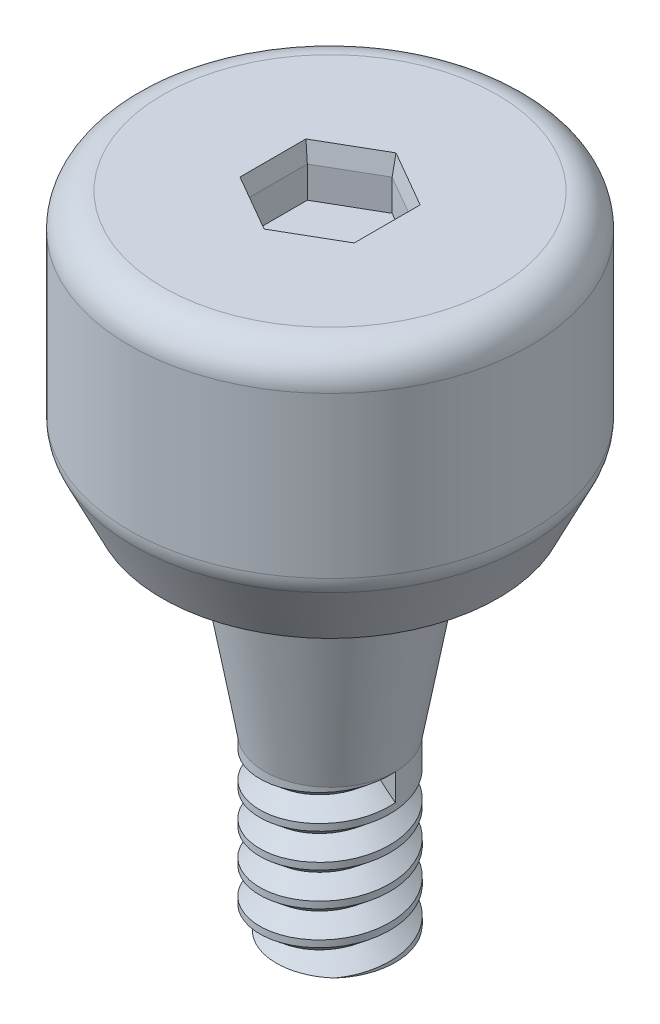
from build123d import *
from build123d.topology import SkipClean

# Parameters (mm, degrees)
ESQUISSE4_W                           = 3.292935648
ESQUISSE4_H                           = 1.153716838
ENL_V_MAT_EXTRU_2_DEPTH               = 1.5
CHANFREIN2_SIZE                       = 0.1
CHANFREIN2_SIZE2                      = 0.567128182
CONG_2_R                              = 1
ENL_VEMENT_DE_MATI_RE_BALAYAGE1_PITCH = 1


with BuildPart() as part:
    # Esquisse1 → Révolution1 (revolve)
    with BuildSketch(Plane.XY, mode=Mode.PRIVATE) as r_volution1_sk:
        with BuildLine():
            Line((-3, 0), (-1.942038116, -6))
            Line((-1.942038116, -6), (-1.942038116, -11))
            Line((-1.942038116, -11), (0, -11))
            Line((0, -11), (0, 0))
            Line((0, 0), (0, 2))
            Line((0, 2), (0, 8))
            Line((0, 8), (-5.968857154, 8))
            Line((-5.968857154, 8), (-5.968857154, 2.229461123))
            ThreePointArc((-5.968857154, 2.229461123), (-5.943526946, 2.005812298), (-5.86881956, 1.793493615))
            Line((-5.86881956, 1.793493615), (-5, 0))
            Line((-5, 0), (-3, 0))
        make_face()
    revolve(r_volution1_sk.sketch.rotate(Axis((0, -11, 0), (0, 1, 0)), 270), axis=Axis((0, -11, 0), (0, 1, 0)))

    # Esquisse4 → Enlèvement de matière-Révolution1 (revolve, cut)
    with BuildSketch(Plane.XY, mode=Mode.PRIVATE) as enl_vement_de_mati_re_r_volution1_sk:
        with Locations((1.646467824, -11.493285508)):
            Rectangle(ESQUISSE4_W, ESQUISSE4_H)
    revolve(enl_vement_de_mati_re_r_volution1_sk.sketch.rotate(Axis((0, -10.860421417, 0), (0, -1, 0)), 270), axis=Axis((0, -10.860421417, 0), (0, -1, 0)), mode=Mode.SUBTRACT)

    # Esquisse6 → Enlèv. mat.-Extru.2 (cut)
    with BuildSketch(Plane(origin=(0, 8, 0), x_dir=(1, 0, 0), z_dir=(0, 1, 0))):
        Polygon((0, 1.847520861), (-1.6, 0.923760431), (-1.6, -0.923760431), (0, -1.847520861), (1.6, -0.923760431), (1.6, 0.923760431), align=None)
    extrude(amount=-ENL_V_MAT_EXTRU_2_DEPTH, mode=Mode.SUBTRACT)

    # Chanfrein2
    chanfrein2_edges = [part.edges().sort_by_distance(p)[0] for p in [
        (0.8, 8, -1.385640646),
        (-0.8, 8, -1.385640646),
        (-1.6, 8, 0),
        (-0.8, 8, 1.385640646),
        (0.8, 8, 1.385640646),
        (1.6, 8, 0),
    ]]
    chanfrein2_side = [part.faces().sort_by_distance(p)[0] for p in [
        (0, 8, 5.800032379),
    ]]
    chamfer(chanfrein2_edges, length=CHANFREIN2_SIZE, length2=CHANFREIN2_SIZE2, reference=chanfrein2_side[0])

    # Congé2
    cong_2_edges = [part.edges().sort_by_distance(p)[0] for p in [
        (0, 8, 5.968857154),
    ]]
    fillet(cong_2_edges, radius=CONG_2_R)

    # Enlèvement de matière-Balayage1: the profile of Esquisse3 profile screwed along a right-hand helix of 5 turns, 8 arcs to a turn; built about Z, then put on its axis
    with SkipClean():  # the faces are left unmerged after this step: merging them gives an invalid solid
        enl_vement_de_mati_re_balayage1_z = Axis((0, 0, 0), (0, 0, 1))
        enl_vement_de_mati_re_balayage1_corners = [(1.942338116, 0, -0.000244898), (1.942338116, 0, 0.800244898), (1.452038116, 0, 0.4)]
        with BuildLine(mode=Mode.PRIVATE) as enl_vement_de_mati_re_balayage1_profile:
            Line(enl_vement_de_mati_re_balayage1_corners[0], enl_vement_de_mati_re_balayage1_corners[1])
            Line(enl_vement_de_mati_re_balayage1_corners[1], enl_vement_de_mati_re_balayage1_corners[2])
            Line(enl_vement_de_mati_re_balayage1_corners[2], enl_vement_de_mati_re_balayage1_corners[0])
        enl_vement_de_mati_re_balayage1_cap = Face(enl_vement_de_mati_re_balayage1_profile.wire())
        enl_vement_de_mati_re_balayage1_turn_angles = [0, 22.5, 45, 67.5, 90, 112.5, 135, 157.5, 180, 202.5, 225, 247.5, 270, 292.5, 315, 337.5, 360]
        enl_vement_de_mati_re_balayage1_turn_weights = [1, 0.9238795325112867, 1, 0.9238795325112867, 1, 0.9238795325112867, 1, 0.9238795325112867, 1, 0.9238795325112867, 1, 0.9238795325112867, 1, 0.9238795325112867, 1, 0.9238795325112867, 1]
        enl_vement_de_mati_re_balayage1_turn_rails = [Edge.make_bspline([Vector(p[0], p[1], 0).rotate(enl_vement_de_mati_re_balayage1_z, enl_vement_de_mati_re_balayage1_turn_angles[k]) / enl_vement_de_mati_re_balayage1_turn_weights[k] + Vector(0, 0, p[2] + ENL_VEMENT_DE_MATI_RE_BALAYAGE1_PITCH * enl_vement_de_mati_re_balayage1_turn_angles[k] / 360) for k in range(17)], [0, 0, 0, 1, 1, 2, 2, 3, 3, 4, 4, 5, 5, 6, 6, 7, 7, 8, 8, 8], 2, enl_vement_de_mati_re_balayage1_turn_weights) for p in enl_vement_de_mati_re_balayage1_corners]
        enl_vement_de_mati_re_balayage1_turn_sides = [Face.make_surface_from_curves(enl_vement_de_mati_re_balayage1_turn_rails[p[0]], enl_vement_de_mati_re_balayage1_turn_rails[p[1]]) for p in [(0, 1), (1, 2), (2, 0)]]
        enl_vement_de_mati_re_balayage1 = Plane(origin=(0, -6, 0), x_dir=(1, 0, 0), z_dir=(0, -1, 0)) * Solid(Shell([*[p.moved(Location((0, 0, ENL_VEMENT_DE_MATI_RE_BALAYAGE1_PITCH * i))) for i in range(5) for p in enl_vement_de_mati_re_balayage1_turn_sides], enl_vement_de_mati_re_balayage1_cap, enl_vement_de_mati_re_balayage1_cap.rotate(enl_vement_de_mati_re_balayage1_z, 1800).moved(Location((0, 0, ENL_VEMENT_DE_MATI_RE_BALAYAGE1_PITCH * 1800 / 360)))]))
        add(enl_vement_de_mati_re_balayage1, mode=Mode.SUBTRACT)


solid = part.part
